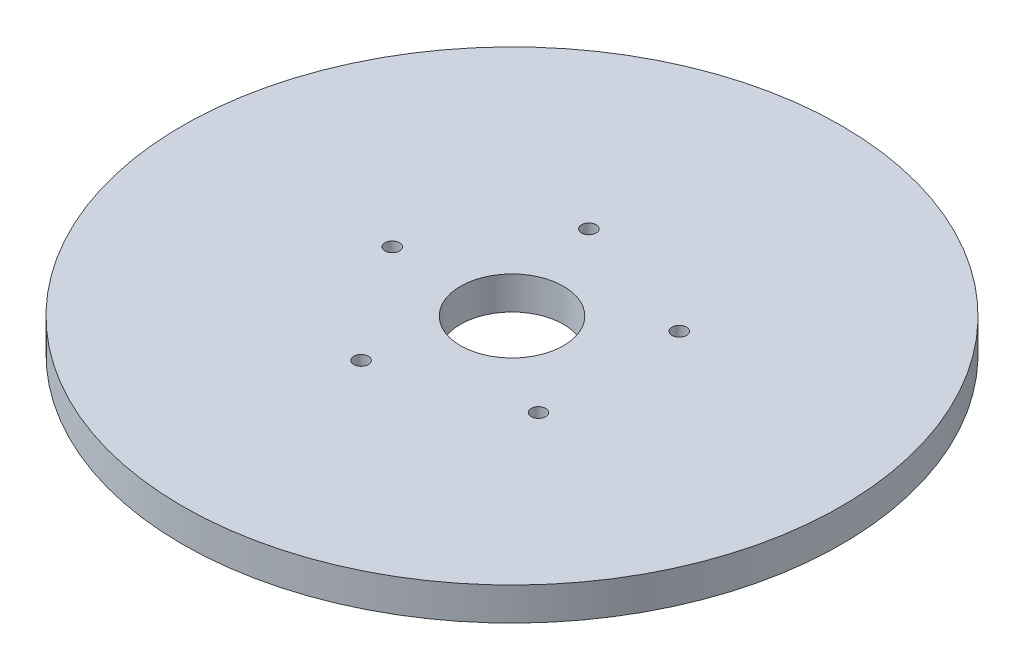
from build123d import *

# Parameters (mm, degrees)
SKETCH1_R           = 80
BOSS_EXTRUDE1_DEPTH = 8
SKETCH2_R           = 12.5
CUT_EXTRUDE1_DEPTH  = 114.41957503
SKETCH3_R           = 1.760899613
CUT_EXTRUDE2_DEPTH  = 6.679833402
CIRPATTERN1_COUNT   = 5


with BuildPart() as part:
    # Sketch1 → Boss-Extrude1 (new body)
    with BuildSketch(Plane(origin=(0, 0, 0), x_dir=(1, 0, 0), z_dir=(0, 1, 0))):
        Circle(SKETCH1_R)
    extrude(amount=BOSS_EXTRUDE1_DEPTH)

    # Sketch2 → Cut-Extrude1 (cut, through all)
    with BuildSketch(Plane(origin=(0, 0, 0), x_dir=(1, 0, 0), z_dir=(0, 1, 0))):
        Circle(SKETCH2_R)
    extrude(amount=CUT_EXTRUDE1_DEPTH, mode=Mode.SUBTRACT)

    # Sketch3 → Cut-Extrude2 (cut)
    with BuildSketch(Plane(origin=(0, 8, 0), x_dir=(1, 0, 0), z_dir=(0, 1, 0))):
        with Locations((-29.070540967, 0)):
            Circle(SKETCH3_R)
    cut_extrude2 = extrude(amount=-CUT_EXTRUDE2_DEPTH, mode=Mode.SUBTRACT)

    # CirPattern1: Cut-Extrude2 ×5 about axis
    cirpattern1_axis = Axis((0, 0, 0), (0, 1, 0))
    for i in range(1, CIRPATTERN1_COUNT):
        add(cut_extrude2.rotate(cirpattern1_axis, i * 360 / CIRPATTERN1_COUNT), mode=Mode.SUBTRACT)


solid = part.part
